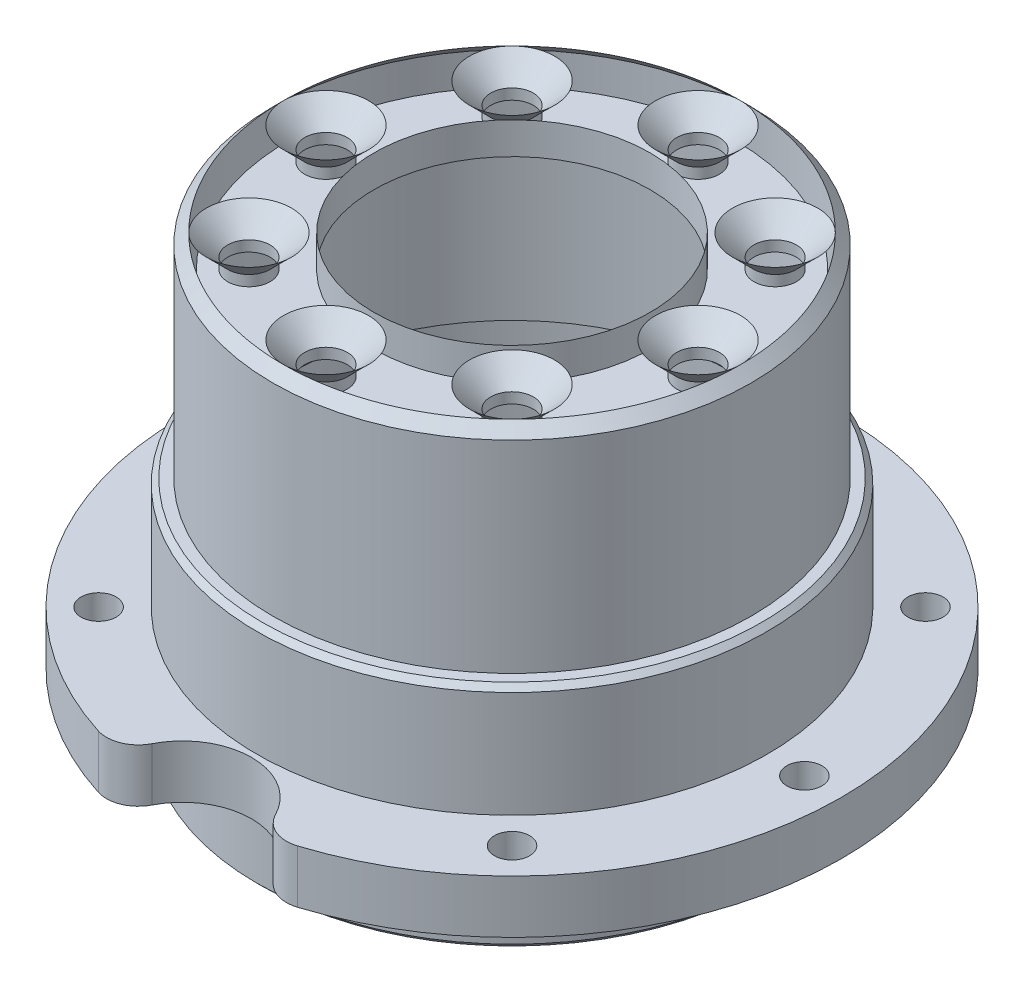
from build123d import *

# Parameters (mm, degrees)
HOLE_WIZARD_M4_1_D        = 3.3
HOLE_WIZARD_1_D           = 4
HOLE_WIZARD_1_CSINK_D     = 8
HOLE_WIZARD_1_CSINK_ANGLE = 90
CHAMFER_1_SIZE            = 0.5
CHAMFER_2_SIZE            = 1
SKETCH_7_R                = 6.5
CUT_EXTRUDE_1_DEPTH       = 54.406460283
FILLET_1_R                = 3


with BuildPart() as part:
    # 草图1 → 旋转1 (revolve)
    with BuildSketch(Plane.XY, mode=Mode.PRIVATE) as revolve_1_sk:
        Polygon((-22.5, 35.5), (-13, 35.5), (-13, 32.5), (-21, 32.5), (-21, 13.5), (-22, 13.5), (-22, -6), (-24, -6), (-24, 0), (-31, 0), (-31, 5), (-24, 5), (-24, 15.5), (-22.5, 15.5), align=None)
    revolve(revolve_1_sk.sketch.rotate(Axis((0, 0, 0), (0, 1, 0)), 270), axis=Axis((0, 0, 0), (0, 1, 0)))

    # M4 螺纹孔1 (through all)
    with Locations(Plane(origin=(0, 5, 0), x_dir=(1, 0, 0), z_dir=(0, 1, 0))):
        with Locations((-19.445436483, 19.445436483), (0, 27.5), (19.445436483, 19.445436483), (27.5, 0), (19.445436483, -19.445436483), (0, -27.5), (-19.445436483, -19.445436483), (-27.5, 0)):
            Hole(HOLE_WIZARD_M4_1_D / 2)

    # 孔1 (through all)
    with Locations(Plane(origin=(0, 35.5, 0), x_dir=(1, 0, 0), z_dir=(0, 1, 0))):
        with Locations((0, 17.5), (12.374368671, 12.374368671), (17.5, 0), (12.374368671, -12.374368671), (0, -17.5), (-12.374368671, -12.374368671), (-17.5, 0), (-12.374368671, 12.374368671)):
            CounterSinkHole(HOLE_WIZARD_1_D / 2, HOLE_WIZARD_1_CSINK_D / 2, counter_sink_angle=HOLE_WIZARD_1_CSINK_ANGLE)

    # 倒角1
    chamfer_1_edges = [part.edges().sort_by_distance(p)[0] for p in [
        (0, -6, 24),
        (0, 15.5, 24),
    ]]
    chamfer(chamfer_1_edges, length=CHAMFER_1_SIZE)

    # 倒角2
    chamfer_2_edges = [part.edges().sort_by_distance(p)[0] for p in [
        (0, 35.5, 22.5),
    ]]
    chamfer(chamfer_2_edges, length=CHAMFER_2_SIZE - 0.0001)  # a hair under: the kernel refuses the full size

    # 草图7 → 切除-拉伸1 (cut, through all)
    with BuildSketch(Plane(origin=(0, 5, 0), x_dir=(1, 0, 0), z_dir=(0, 1, 0))):
        with Locations((0, -31)):
            Circle(SKETCH_7_R)
    extrude(amount=-CUT_EXTRUDE_1_DEPTH, mode=Mode.SUBTRACT)

    # 圆角1
    fillet_1_edges = [part.edges().sort_by_distance(p)[0] for p in [
        (-6.464180048, 2.5, 30.318548387),
        (6.464180048, 2.5, 30.318548387),
    ]]
    fillet(fillet_1_edges, radius=FILLET_1_R)


solid = part.part
